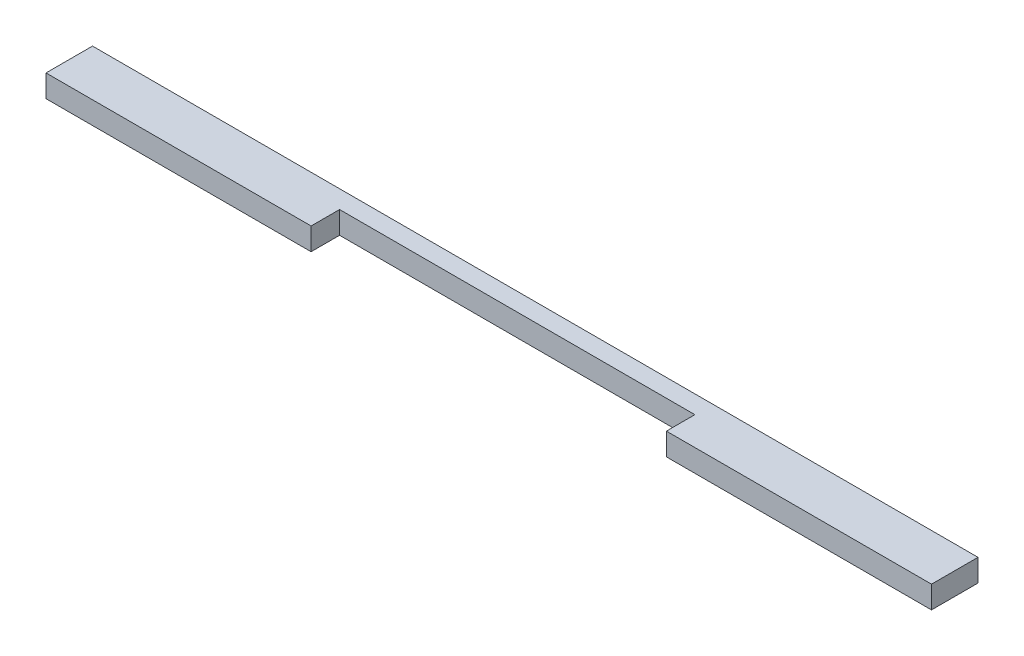
from build123d import *

# Parameters (mm, degrees)
BOSS_EXTRUDE1_DEPTH = 12


with BuildPart() as part:
    # Sketch2 → Boss-Extrude1 (new body)
    with BuildSketch(Plane(origin=(0, 0, 0), x_dir=(1, 0, 0), z_dir=(0, 1, 0))):
        Polygon((0, 25), (0, 0), (142.5, 0), (142.5, 15.309556752), (333.5, 15.309556752), (333.5, 0), (476, 0), (476, 25), align=None)
    extrude(amount=BOSS_EXTRUDE1_DEPTH)


solid = part.part
